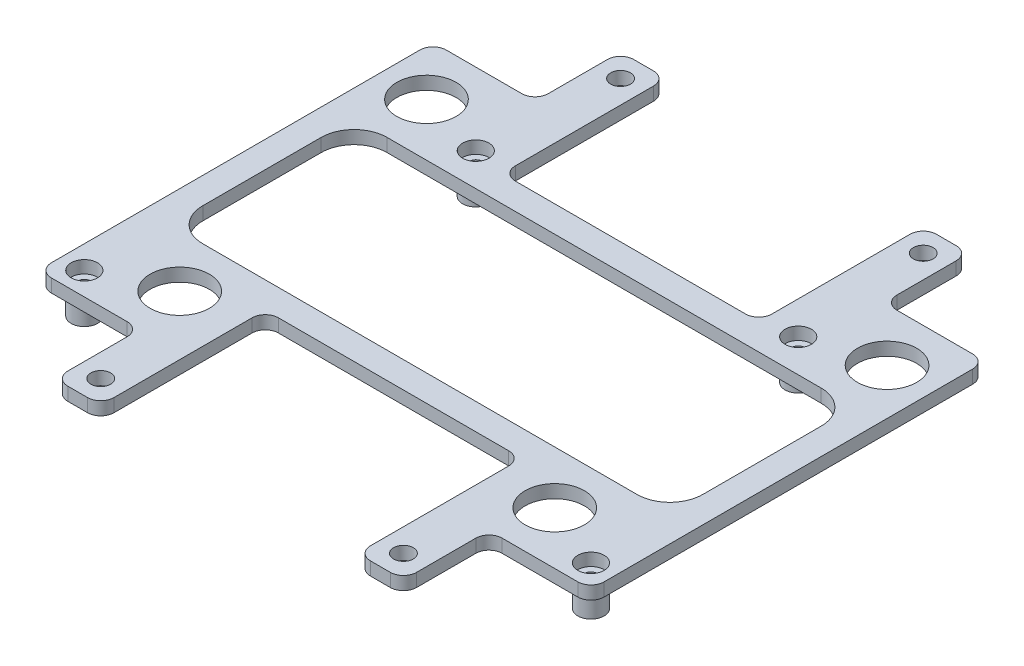
from build123d import *

# Parameters (mm, degrees)
SKETCH_1_W          = 84
SKETCH_1_H          = 60
SKETCH_1_R          = 1
EXTRUDE_1_DEPTH     = 2
SKETCH_3_R          = 2
CUT_EXTRUDE_1_DEPTH = 1.9
SKETCH_4_R          = 2
SKETCH_4_R_2        = 1
EXTRUDE_2_DEPTH     = 4
FILLET_1_R          = 1.5
FILLET_3_R          = 2
SKETCH_6_W          = 7
SKETCH_6_H          = 13
SKETCH_6_R          = 1.5
EXTRUDE_4_DEPTH     = 2
CUT_EXTRUDE_2_REACH = 62.241
SKETCH_5_R          = 4.5
SKETCH_5_W          = 39
SKETCH_5_H          = 12
SKETCH_5_W_2        = 76
SKETCH_5_H_2        = 28
FILLET_6_R          = 2
FILLET_7_R          = 2
FILLET_8_R          = 5


with BuildPart() as part:
    # 草图1 → 凸台-拉伸1 (new body)
    with BuildSketch(Plane(origin=(0, 0, 0), x_dir=(1, 0, 0), z_dir=(0, 1, 0))):
        Rectangle(SKETCH_1_W, SKETCH_1_H)
        with Locations(Location((-38.5, -26.5, 0), (0, 0, 270))):
            Circle(SKETCH_1_R, mode=Mode.SUBTRACT)
        with Locations(Location((38.5, -26.5, 0), (0, 0, 270))):
            Circle(SKETCH_1_R, mode=Mode.SUBTRACT)
        with Locations(Location((-24.5, 19, 0), (0, 0, 270))):
            Circle(SKETCH_1_R, mode=Mode.SUBTRACT)
        with Locations(Location((24.5, 19, 0), (0, 0, 270))):
            Circle(SKETCH_1_R, mode=Mode.SUBTRACT)
    extrude(amount=EXTRUDE_1_DEPTH)

    # 草图3 → 切除-拉伸1 (cut)
    with BuildSketch(Plane(origin=(0, 2, 0), x_dir=(1, 0, 0), z_dir=(0, 1, 0))):
        with Locations(Location((-24.5, 19, 0), (0, 0, 270))):
            Circle(SKETCH_3_R)
        with Locations(Location((24.5, 19, 0), (0, 0, 270))):
            Circle(SKETCH_3_R)
        with Locations(Location((38.5, -26.5, 0), (0, 0, 270))):
            Circle(SKETCH_3_R)
        with Locations(Location((-38.5, -26.5, 0), (0, 0, 270))):
            Circle(SKETCH_3_R)
    extrude(amount=-CUT_EXTRUDE_1_DEPTH, mode=Mode.SUBTRACT)

    # 草图4 → 凸台-拉伸2 (add)
    # profile 1 of 4: a face of its own
    with BuildSketch(Plane.XZ):
        with Locations(Location((-38.5, 26.5, 0), (0, 0, 90))):
            Circle(SKETCH_4_R)
        with Locations(Location((-38.5, 26.5, 0), (0, 0, 270))):
            Circle(SKETCH_4_R_2, mode=Mode.SUBTRACT)
    # profile 2 of 4: a face of its own
    with BuildSketch(Plane.XZ):
        with Locations(Location((38.5, 26.5, 0), (0, 0, 90))):
            Circle(SKETCH_4_R)
        with Locations(Location((38.5, 26.5, 0), (0, 0, 270))):
            Circle(SKETCH_4_R_2, mode=Mode.SUBTRACT)
    # profile 3 of 4: a face of its own
    with BuildSketch(Plane.XZ):
        with Locations(Location((24.5, -19, 0), (0, 0, 90))):
            Circle(SKETCH_4_R)
        with Locations(Location((24.5, -19, 0), (0, 0, 270))):
            Circle(SKETCH_4_R_2, mode=Mode.SUBTRACT)
    # profile 4 of 4: a face of its own
    with BuildSketch(Plane.XZ):
        with Locations(Location((-24.5, -19, 0), (0, 0, 90))):
            Circle(SKETCH_4_R)
        with Locations(Location((-24.5, -19, 0), (0, 0, 270))):
            Circle(SKETCH_4_R_2, mode=Mode.SUBTRACT)
    extrude(amount=EXTRUDE_2_DEPTH)

    # 圆角1
    fillet_1_edges = [part.edges().sort_by_distance(p)[0] for p in [
        (-38.5, 0, 24.5),
        (38.5, 0, 24.5),
        (24.5, 0, -21),
        (-24.5, 0, -21),
    ]]
    fillet(fillet_1_edges, radius=FILLET_1_R - 0.0001)  # a hair under: the kernel refuses the full size

    # 圆角3
    fillet_3_edges = [part.edges().sort_by_distance(p)[0] for p in [
        (42, 1, 30),
        (-42, 1, 30),
        (-42, 1, -30),
        (42, 1, -30),
    ]]
    fillet(fillet_3_edges, radius=FILLET_3_R)

    # 草图6 → 凸台-拉伸4 (add)
    # profile 1 of 4: a face of its own
    with BuildSketch(Plane.XZ):
        with Locations((-23, 36.5)):
            Rectangle(SKETCH_6_W, SKETCH_6_H)
        with Locations(Location((-23, 39.5, 0), (0, 0, 270))):
            Circle(SKETCH_6_R, mode=Mode.SUBTRACT)
    # profile 2 of 4: a face of its own
    with BuildSketch(Plane.XZ):
        with Locations((23, 36.5)):
            Rectangle(SKETCH_6_W, SKETCH_6_H)
        with Locations(Location((23, 39.5, 0), (0, 0, 270))):
            Circle(SKETCH_6_R, mode=Mode.SUBTRACT)
    # profile 3 of 4: a face of its own
    with BuildSketch(Plane.XZ):
        with Locations((23, -36.5)):
            Rectangle(SKETCH_6_W, SKETCH_6_H)
        with Locations(Location((23, -39.5, 0), (0, 0, 270))):
            Circle(SKETCH_6_R, mode=Mode.SUBTRACT)
    # profile 4 of 4: a face of its own
    with BuildSketch(Plane.XZ):
        with Locations((-23, -36.5)):
            Rectangle(SKETCH_6_W, SKETCH_6_H)
        with Locations(Location((-23, -39.5, 0), (0, 0, 270))):
            Circle(SKETCH_6_R, mode=Mode.SUBTRACT)
    extrude(amount=-EXTRUDE_4_DEPTH)

    # 草图5 → 切除-拉伸2 (cut, up to next)
    with BuildSketch(Plane.XZ, mode=Mode.PRIVATE) as cut_extrude_2_sk1:
        with Locations(Location((-28.5, 22, 0), (0, 0, 270))):
            Circle(SKETCH_5_R)
    cut_extrude_2_tool1 = extrude(cut_extrude_2_sk1.sketch, amount=-CUT_EXTRUDE_2_REACH, mode=Mode.PRIVATE) & part.part
    # 草图5 → 切除-拉伸2 (cut, up to next)
    with BuildSketch(Plane.XZ, mode=Mode.PRIVATE) as cut_extrude_2_sk2:
        with Locations(Location((-35, -22, 0), (0, 0, 270))):
            Circle(SKETCH_5_R)
    cut_extrude_2_tool2 = extrude(cut_extrude_2_sk2.sketch, amount=-CUT_EXTRUDE_2_REACH, mode=Mode.PRIVATE) & part.part
    # 草图5 → 切除-拉伸2 (cut, up to next)
    with BuildSketch(Plane.XZ, mode=Mode.PRIVATE) as cut_extrude_2_sk3:
        with Locations(Location((35, -22, 0), (0, 0, 270))):
            Circle(SKETCH_5_R)
    cut_extrude_2_tool3 = extrude(cut_extrude_2_sk3.sketch, amount=-CUT_EXTRUDE_2_REACH, mode=Mode.PRIVATE) & part.part
    # 草图5 → 切除-拉伸2 (cut, up to next)
    with BuildSketch(Plane.XZ, mode=Mode.PRIVATE) as cut_extrude_2_sk4:
        with Locations(Location((28.5, 22, 0), (0, 0, 270))):
            Circle(SKETCH_5_R)
    cut_extrude_2_tool4 = extrude(cut_extrude_2_sk4.sketch, amount=-CUT_EXTRUDE_2_REACH, mode=Mode.PRIVATE) & part.part
    # 草图5 → 切除-拉伸2 (cut, up to next)
    with BuildSketch(Plane.XZ, mode=Mode.PRIVATE) as cut_extrude_2_sk5:
        with Locations((0, -24)):
            Rectangle(SKETCH_5_W, SKETCH_5_H)
    cut_extrude_2_tool5 = extrude(cut_extrude_2_sk5.sketch, amount=-CUT_EXTRUDE_2_REACH, mode=Mode.PRIVATE) & part.part
    # 草图5 → 切除-拉伸2 (cut, up to next)
    with BuildSketch(Plane.XZ, mode=Mode.PRIVATE) as cut_extrude_2_sk6:
        with Locations((0, 24)):
            Rectangle(SKETCH_5_W, SKETCH_5_H)
    cut_extrude_2_tool6 = extrude(cut_extrude_2_sk6.sketch, amount=-CUT_EXTRUDE_2_REACH, mode=Mode.PRIVATE) & part.part
    # 草图5 → 切除-拉伸2 (cut, up to next)
    with BuildSketch(Plane.XZ, mode=Mode.PRIVATE) as cut_extrude_2_sk7:
        Rectangle(SKETCH_5_W_2, SKETCH_5_H_2)
    cut_extrude_2_tool7 = extrude(cut_extrude_2_sk7.sketch, amount=-CUT_EXTRUDE_2_REACH, mode=Mode.PRIVATE) & part.part
    add(cut_extrude_2_tool1.solids().sort_by_distance((-28.5, 0, 22))[0], mode=Mode.SUBTRACT)
    add(cut_extrude_2_tool2.solids().sort_by_distance((-35, 0, -22))[0], mode=Mode.SUBTRACT)
    add(cut_extrude_2_tool3.solids().sort_by_distance((35, 0, -22))[0], mode=Mode.SUBTRACT)
    add(cut_extrude_2_tool4.solids().sort_by_distance((28.5, 0, 22))[0], mode=Mode.SUBTRACT)
    add(cut_extrude_2_tool5.solids().sort_by_distance((0, 0, -24))[0], mode=Mode.SUBTRACT)
    add(cut_extrude_2_tool6.solids().sort_by_distance((0, 0, 24))[0], mode=Mode.SUBTRACT)
    add(cut_extrude_2_tool7.solids().sort_by_distance((0, 0, 0))[0], mode=Mode.SUBTRACT)

    # 圆角6
    fillet_6_edges = [part.edges().sort_by_distance(p)[0] for p in [
        (-26.5, 1, 30),
        (26.5, 1, 30),
        (26.5, 1, -30),
        (-26.5, 1, -30),
        (19.5, 1, 18),
        (-19.5, 1, 18),
        (19.5, 1, -18),
        (-19.5, 1, -18),
    ]]
    fillet(fillet_6_edges, radius=FILLET_6_R)

    # 圆角7
    fillet_7_edges = [part.edges().sort_by_distance(p)[0] for p in [
        (-26.5, 1, 43),
        (-19.5, 1, 43),
        (19.5, 1, 43),
        (26.5, 1, 43),
        (19.5, 1, -43),
        (26.5, 1, -43),
        (-26.5, 1, -43),
        (-19.5, 1, -43),
    ]]
    fillet(fillet_7_edges, radius=FILLET_7_R)

    # 圆角8
    fillet_8_edges = [part.edges().sort_by_distance(p)[0] for p in [
        (-38, 1, 14),
        (-38, 1, -14),
        (38, 1, -14),
        (38, 1, 14),
    ]]
    fillet(fillet_8_edges, radius=FILLET_8_R)


solid = part.part
